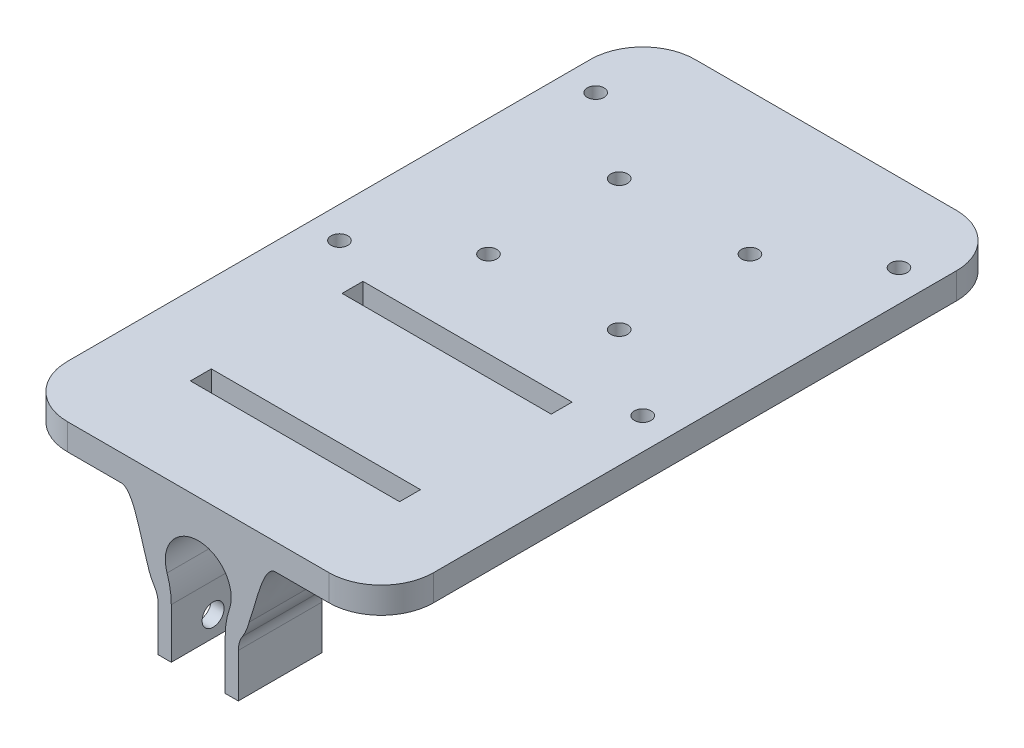
from build123d import *

# Parameters (mm, degrees)
BOSS_EXTRUDE2_START = 10
SKETCH3_W           = 70
SKETCH3_H           = 5
BOSS_EXTRUDE2_DEPTH = 120
BOSS_EXTRUDE3_START = 18
BOSS_EXTRUDE3_DEPTH = 8
SKETCH4_R           = 2.1
CUT_EXTRUDE1_DEPTH  = 11
FILLET1_R           = 10
SKETCH5_R           = 1.6
CUT_EXTRUDE2_DEPTH  = 11
CUT_EXTRUDE5_REACH  = 139.915
SKETCH7_R           = 1.6
CUT_EXTRUDE6_REACH  = 139.915
SKETCH6_W           = 40
SKETCH6_H           = 4


with BuildPart() as part:
    # Sketch3 → Boss-Extrude2 (new body)
    with BuildSketch(Plane.XY.offset(BOSS_EXTRUDE2_START)):
        with Locations((0, 11)):
            Rectangle(SKETCH3_W, SKETCH3_H)
    extrude(amount=BOSS_EXTRUDE2_DEPTH)

    # Sketch1 → Boss-Extrude3 (add, symmetric)
    with BuildSketch(Plane.XY.offset(BOSS_EXTRUDE3_START)):
        with BuildLine():
            Line((-14.625621312, 8.5), (14.625621312, 8.5))
            add(Edge.make_bspline(
                [(14.625621312, 8.5), (12.253002272, 8.152861079), (11.086674652, 1.382068579), (9.719671925, -2.351165174)],
                knots=[0, 0, 0, 0, 1, 1, 1, 1], degree=3))
            ThreePointArc((9.719671925, -2.351165174), (9.204012528, -3.909751064), (8.440296287, -5.362965465))
            ThreePointArc((8.440296287, -5.362965465), (7.859364307, -6.648156809), (7.660444431, -8.044448198))
            Line((7.660444431, -8.044448198), (7.660444431, -16.427876097))
            Line((7.660444431, -16.427876097), (6.160444431, -16.427876097))
            Line((6.160444431, -16.427876097), (5.160444431, -16.427876097))
            Line((5.160444431, -16.427876097), (5.160444431, -6.87360752))
            ThreePointArc((5.160444431, -6.87360752), (5.362430355, -4.42028744), (5.962948353, -2.033038844))
            ThreePointArc((5.962948353, -2.033038844), (0, 6.3), (-5.962948353, -2.033038844))
            ThreePointArc((-5.962948353, -2.033038844), (-5.362430355, -4.42028744), (-5.160444431, -6.87360752))
            Line((-5.160444431, -6.87360752), (-5.160444431, -16.427876097))
            Line((-5.160444431, -16.427876097), (-6.160444431, -16.427876097))
            Line((-6.160444431, -16.427876097), (-7.660444431, -16.427876097))
            Line((-7.660444431, -16.427876097), (-7.660444431, -8.044448198))
            ThreePointArc((-7.660444431, -8.044448198), (-7.859364307, -6.648156809), (-8.440296287, -5.362965465))
            ThreePointArc((-8.440296287, -5.362965465), (-9.204012528, -3.909751064), (-9.719671925, -2.351165174))
            add(Edge.make_bspline(
                [(-14.625621312, 8.5), (-12.253002272, 8.152861079), (-11.086674652, 1.382068579), (-9.719671925, -2.351165174)],
                knots=[0, 0, 0, 0, 1, 1, 1, 1], degree=3))
        make_face()
    boss_extrude3 = extrude(amount=BOSS_EXTRUDE3_DEPTH, both=True)

    # Sketch4 → Cut-Extrude1 (cut)
    with BuildSketch(Plane.ZY.offset(7.660444431)):
        with Locations((18, -12.521824291)):
            Circle(SKETCH4_R)
    cut_extrude1 = extrude(amount=-CUT_EXTRUDE1_DEPTH, mode=Mode.SUBTRACT)

    # Mirror2: Boss-Extrude3, Cut-Extrude1 across plane
    add(boss_extrude3.mirror(Plane.XY.offset(70)))
    add(cut_extrude1.mirror(Plane.XY.offset(70)), mode=Mode.SUBTRACT)

    # Fillet1
    fillet1_edges = [part.edges().sort_by_distance(p)[0] for p in [
        (35, 11, 10),
        (35, 11, 130),
        (-35, 11, 130),
        (-35, 11, 10),
    ]]
    fillet(fillet1_edges, radius=FILLET1_R)

    # Sketch5 → Cut-Extrude2 (cut)
    with BuildSketch(Plane(origin=(0, 13.5, 0), x_dir=(1, 0, 0), z_dir=(0, 1, 0))):
        with Locations((29, -25)):
            Circle(SKETCH5_R)
        with Locations((29, -74)):
            Circle(SKETCH5_R)
        with Locations((-29, -74)):
            Circle(SKETCH5_R)
        with Locations((-29, -25)):
            Circle(SKETCH5_R)
    extrude(amount=-CUT_EXTRUDE2_DEPTH, mode=Mode.SUBTRACT)

    # Sketch7 → Cut-Extrude5 (cut, up to next)
    with BuildSketch(Plane(origin=(0, 13.5, 0), x_dir=(1, 0, 0), z_dir=(0, 1, 0)), mode=Mode.PRIVATE) as cut_extrude5_sk1:
        with Locations((12.5, -37)):
            Circle(SKETCH7_R)
    cut_extrude5_tool1 = extrude(cut_extrude5_sk1.sketch, amount=-CUT_EXTRUDE5_REACH, mode=Mode.PRIVATE) & part.part
    # Sketch7 → Cut-Extrude5 (cut, up to next)
    with BuildSketch(Plane(origin=(0, 13.5, 0), x_dir=(1, 0, 0), z_dir=(0, 1, 0)), mode=Mode.PRIVATE) as cut_extrude5_sk2:
        with Locations((12.5, -62)):
            Circle(SKETCH7_R)
    cut_extrude5_tool2 = extrude(cut_extrude5_sk2.sketch, amount=-CUT_EXTRUDE5_REACH, mode=Mode.PRIVATE) & part.part
    # Sketch7 → Cut-Extrude5 (cut, up to next)
    with BuildSketch(Plane(origin=(0, 13.5, 0), x_dir=(1, 0, 0), z_dir=(0, 1, 0)), mode=Mode.PRIVATE) as cut_extrude5_sk3:
        with Locations((-12.5, -62)):
            Circle(SKETCH7_R)
    cut_extrude5_tool3 = extrude(cut_extrude5_sk3.sketch, amount=-CUT_EXTRUDE5_REACH, mode=Mode.PRIVATE) & part.part
    # Sketch7 → Cut-Extrude5 (cut, up to next)
    with BuildSketch(Plane(origin=(0, 13.5, 0), x_dir=(1, 0, 0), z_dir=(0, 1, 0)), mode=Mode.PRIVATE) as cut_extrude5_sk4:
        with Locations((-12.5, -37)):
            Circle(SKETCH7_R)
    cut_extrude5_tool4 = extrude(cut_extrude5_sk4.sketch, amount=-CUT_EXTRUDE5_REACH, mode=Mode.PRIVATE) & part.part
    add(cut_extrude5_tool1.solids().sort_by_distance((12.5, 13.5, 37))[0], mode=Mode.SUBTRACT)
    add(cut_extrude5_tool2.solids().sort_by_distance((12.5, 13.5, 62))[0], mode=Mode.SUBTRACT)
    add(cut_extrude5_tool3.solids().sort_by_distance((-12.5, 13.5, 62))[0], mode=Mode.SUBTRACT)
    add(cut_extrude5_tool4.solids().sort_by_distance((-12.5, 13.5, 37))[0], mode=Mode.SUBTRACT)

    # Sketch6 → Cut-Extrude6 (cut, up to next)
    with BuildSketch(Plane(origin=(0, 13.5, 0), x_dir=(1, 0, 0), z_dir=(0, 1, 0)), mode=Mode.PRIVATE) as cut_extrude6_sk1:
        with Locations((0, -80.5)):
            Rectangle(SKETCH6_W, SKETCH6_H)
    cut_extrude6_tool1 = extrude(cut_extrude6_sk1.sketch, amount=-CUT_EXTRUDE6_REACH, mode=Mode.PRIVATE) & part.part
    # Sketch6 → Cut-Extrude6 (cut, up to next)
    with BuildSketch(Plane(origin=(0, 13.5, 0), x_dir=(1, 0, 0), z_dir=(0, 1, 0)), mode=Mode.PRIVATE) as cut_extrude6_sk2:
        with Locations((0, -109.5)):
            Rectangle(SKETCH6_W, SKETCH6_H)
    cut_extrude6_tool2 = extrude(cut_extrude6_sk2.sketch, amount=-CUT_EXTRUDE6_REACH, mode=Mode.PRIVATE) & part.part
    add(cut_extrude6_tool1.solids().sort_by_distance((0, 13.5, 80.5))[0], mode=Mode.SUBTRACT)
    add(cut_extrude6_tool2.solids().sort_by_distance((0, 13.5, 109.5))[0], mode=Mode.SUBTRACT)


solid = part.part
